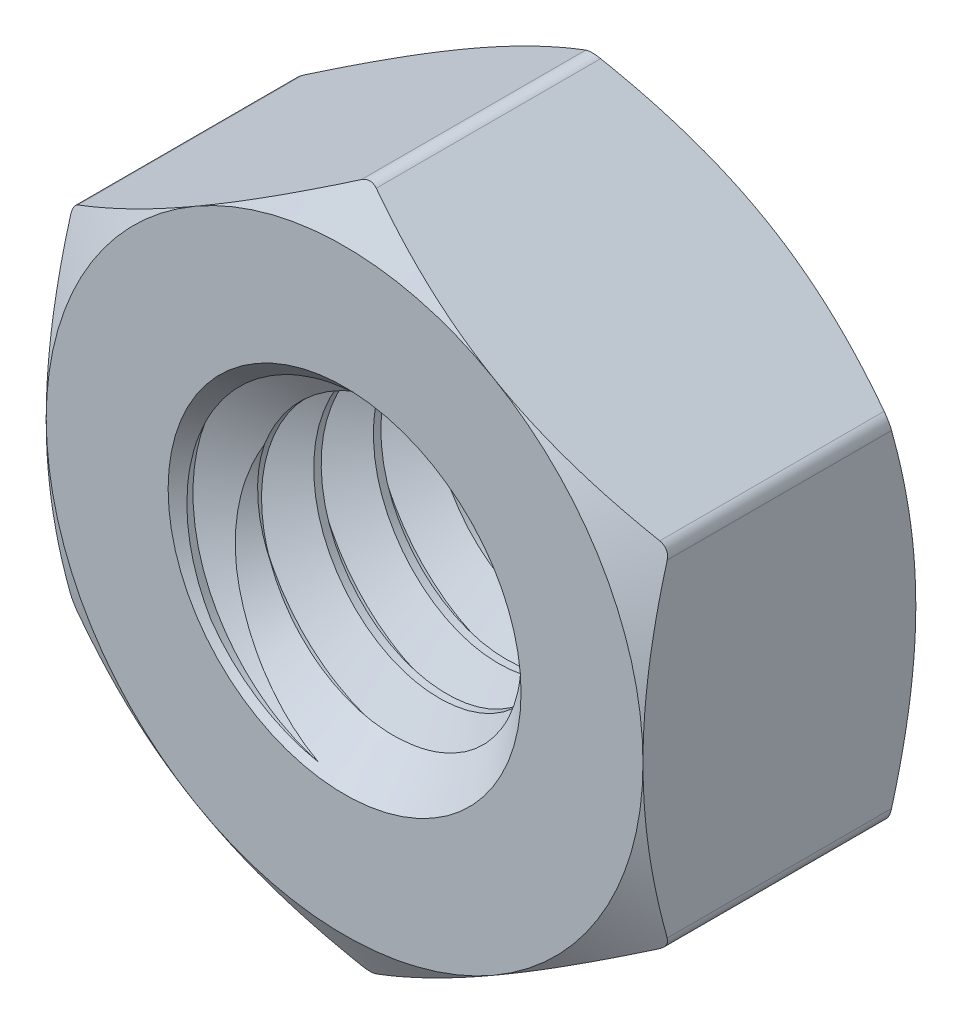
from build123d import *

# Parameters (mm, degrees)
BOSS_EXTRUDE2_DEPTH     = 1.6
CUT_EXTRUDE4_DEPTH      = 6.580621232
CUT_EXTRUDE4_DEPTH_BACK = 6.580621232
SKETCH16_R              = 2
SKETCH7_OUTSIDE_W       = 36.28
SKETCH7_OUTSIDE_H       = 37.362
SKETCH7_OUTSIDE_R       = 3.5
CUT_EXTRUDE5_DEPTH      = 7.23083729
CUT_EXTRUDE5_DRAFT      = -60
MIRROR4_COPY_1_SKETCH_W = 36.28
MIRROR4_COPY_1_SKETCH_H = 37.362
MIRROR4_COPY_1_SKETCH_R = 3.5
MIRROR4_COPY_1_DEPTH    = 7.23083729
MIRROR4_COPY_1_DRAFT    = -60
FILLET2_R               = 0.175
SKETCH13_R              = 2
BOSS_EXTRUDE1_DEPTH     = 3.2
CUT_SWEEP1_PITCH        = 0.7
SKETCH17_R              = 2
BOSS_EXTRUDE3_DEPTH     = 3.2


with BuildPart() as part:
    # Sketch15 → Boss-Extrude2 (new, symmetric)
    with BuildSketch(Plane.XY):
        Polygon((0, 4.041451884), (-3.5, 2.020725942), (-3.5, -2.020725942), (0, -4.041451884), (3.5, -2.020725942), (3.5, 2.020725942), align=None)
    extrude(amount=BOSS_EXTRUDE2_DEPTH, both=True)

    # Sketch16 → Cut-Extrude4 (cut, two sides: drawn at the far end of the back side and taken through both)
    with BuildSketch(Plane.XY.offset(-CUT_EXTRUDE4_DEPTH_BACK)):
        Circle(SKETCH16_R)
    extrude(amount=CUT_EXTRUDE4_DEPTH + CUT_EXTRUDE4_DEPTH_BACK, mode=Mode.SUBTRACT)


with BuildPart() as cut_extrude5_tool:
    # Sketch7 outside → Cut-Extrude5 (with draft: the straight prism first)
    with BuildSketch(Plane.XY.offset(1.6)):
        Rectangle(SKETCH7_OUTSIDE_W, SKETCH7_OUTSIDE_H)
        Circle(SKETCH7_OUTSIDE_R, mode=Mode.SUBTRACT)
    extrude(amount=-CUT_EXTRUDE5_DEPTH)
    # Cut-Extrude5: the draft: its side faces are tilted about the plane it starts from
    cut_extrude5_sides = [cut_extrude5_tool.faces().sort_by_distance(p)[0] for p in [
        (0, -18.681, -2.015418645),
        (18.14, 0, -2.015418645),
        (0, 18.681, -2.015418645),
        (-18.14, 0, -2.015418645),
        (-3.5, 0, -2.015418645),
    ]]
    draft(cut_extrude5_sides, Plane.XY.offset(1.6), CUT_EXTRUDE5_DRAFT)


with BuildPart() as part_1:
    add(part.part)

    # Cut-Extrude5: cut by cut_extrude5_tool
    add(cut_extrude5_tool.part, mode=Mode.SUBTRACT)


with BuildPart() as mirror4_copy_1_tool:
    # Mirror4 copy 1 sketch → Mirror4 copy 1 (with draft: the straight prism first)
    with BuildSketch(Plane(origin=(0, 0, -1.6), x_dir=(1, 0, 0), z_dir=(0, 0, -1))):
        Rectangle(MIRROR4_COPY_1_SKETCH_W, MIRROR4_COPY_1_SKETCH_H)
        Circle(MIRROR4_COPY_1_SKETCH_R, mode=Mode.SUBTRACT)
    extrude(amount=-MIRROR4_COPY_1_DEPTH)
    # Mirror4 copy 1: the draft: its side faces are tilted about the plane it starts from
    mirror4_copy_1_sides = [mirror4_copy_1_tool.faces().sort_by_distance(p)[0] for p in [
        (0, -18.681, 2.015418645),
        (18.14, 0, 2.015418645),
        (0, 18.681, 2.015418645),
        (-18.14, 0, 2.015418645),
        (-3.5, 0, 2.015418645),
    ]]
    draft(mirror4_copy_1_sides, Plane(origin=(0, 0, -1.6), x_dir=(1, 0, 0), z_dir=(0, 0, -1)), MIRROR4_COPY_1_DRAFT)


with BuildPart() as part_2:
    add(part_1.part)

    # Mirror4 copy 1: cut by mirror4_copy_1_tool
    add(mirror4_copy_1_tool.part, mode=Mode.SUBTRACT)

    # Fillet2
    fillet2_edges = [part_2.edges().sort_by_distance(p)[0] for p in [
        (-3.5, 2.020725942, 0),
        (-3.5, -2.020725942, 0),
        (0, -4.041451884, 0),
        (3.5, -2.020725942, 0),
        (3.5, 2.020725942, 0),
        (0, 4.041451884, 0),
    ]]
    fillet(fillet2_edges, radius=FILLET2_R)

    # Sketch17 → Boss-Extrude3 (add)
    with BuildSketch(Plane.XY.offset(1.6)):
        Circle(SKETCH17_R)
    extrude(amount=-BOSS_EXTRUDE3_DEPTH)


with BuildPart() as body_2:
    # Sketch13 → Boss-Extrude1 (new body)
    with BuildSketch(Plane(origin=(0, 0, -1.6), x_dir=(-1, 0, 0), z_dir=(0, 0, -1))):
        Circle(SKETCH13_R)
    extrude(amount=-BOSS_EXTRUDE1_DEPTH)

    # Cut-Sweep1: the profile of Sketch12 profile screwed along a right-hand helix of 6.571429 turns, 6 arcs to a turn; built about Z, then put on its axis
    cut_sweep1_z = Axis((0, 0, 0), (0, 0, 1))
    cut_sweep1_corners = [(2.0003, 0, -0.612673205), (2.0003, 0, 0.000173205), (1.545336663, 0, -0.2625), (1.545336663, 0, -0.35)]
    with BuildLine(mode=Mode.PRIVATE) as cut_sweep1_profile:
        Line(cut_sweep1_corners[0], cut_sweep1_corners[1])
        Line(cut_sweep1_corners[1], cut_sweep1_corners[2])
        Line(cut_sweep1_corners[2], cut_sweep1_corners[3])
        Line(cut_sweep1_corners[3], cut_sweep1_corners[0])
    cut_sweep1_cap = Face(cut_sweep1_profile.wire())
    cut_sweep1_turn_angles = [0, 30, 60, 90, 120, 150, 180, 210, 240, 270, 300, 330, 360]
    cut_sweep1_turn_weights = [1, 0.8660254037844387, 1, 0.8660254037844387, 1, 0.8660254037844387, 1, 0.8660254037844387, 1, 0.8660254037844387, 1, 0.8660254037844387, 1]
    cut_sweep1_turn_rails = [Edge.make_bspline([Vector(p[0], p[1], 0).rotate(cut_sweep1_z, cut_sweep1_turn_angles[k]) / cut_sweep1_turn_weights[k] + Vector(0, 0, p[2] + CUT_SWEEP1_PITCH * cut_sweep1_turn_angles[k] / 360) for k in range(13)], [0, 0, 0, 1, 1, 2, 2, 3, 3, 4, 4, 5, 5, 6, 6, 6], 2, cut_sweep1_turn_weights) for p in cut_sweep1_corners]
    cut_sweep1_turn_sides = [Face.make_surface_from_curves(cut_sweep1_turn_rails[p[0]], cut_sweep1_turn_rails[p[1]]) for p in [(0, 1), (1, 2), (2, 3), (3, 0)]]
    cut_sweep1_last_angles = [2160, 2190, 2220, 2250, 2280, 2310, 2340, 2352.857142857, 2365.714285714]
    cut_sweep1_last_weights = [1, 0.8660254037844387, 1, 0.8660254037844387, 1, 0.8660254037844387, 1, 0.9749279121818208, 1]
    cut_sweep1_last_rails = [Edge.make_bspline([Vector(p[0], p[1], 0).rotate(cut_sweep1_z, cut_sweep1_last_angles[k]) / cut_sweep1_last_weights[k] + Vector(0, 0, p[2] + CUT_SWEEP1_PITCH * cut_sweep1_last_angles[k] / 360) for k in range(9)], [0, 0, 0, 1, 1, 2, 2, 3, 3, 4, 4, 4], 2, cut_sweep1_last_weights) for p in cut_sweep1_corners]
    cut_sweep1_last_sides = [Face.make_surface_from_curves(cut_sweep1_last_rails[p[0]], cut_sweep1_last_rails[p[1]]) for p in [(0, 1), (1, 2), (2, 3), (3, 0)]]
    cut_sweep1 = Plane(origin=(0, 0, -1.6), x_dir=(0, 1, 0), z_dir=(0, 0, 1)) * Solid(Shell([*[p.moved(Location((0, 0, CUT_SWEEP1_PITCH * i))) for i in range(6) for p in cut_sweep1_turn_sides], *cut_sweep1_last_sides, cut_sweep1_cap, cut_sweep1_cap.rotate(cut_sweep1_z, 2365.714285714).moved(Location((0, 0, CUT_SWEEP1_PITCH * 2365.714285714 / 360)))]))
    add(cut_sweep1, mode=Mode.SUBTRACT)


with BuildPart() as part_3:
    add(part_2.part)

    # Combine1: cut body 2
    add(body_2.part, mode=Mode.SUBTRACT)

    # Cut-Extrude2 cone 1 section (through the dimple's axis) → Cut-Extrude2 (revolve, cut)
    with BuildSketch(Plane(origin=(0, 0, 1.6), x_dir=(0, -1, 0), z_dir=(1, 0, 0))):
        Polygon((0, 0), (2.07, 0), (0, 2.07), align=None)
    revolve(axis=Axis((0, 0, 1.6), (0, 0, -1)), mode=Mode.SUBTRACT)

    # Cut-Extrude3 cone 1 section (through the dimple's axis) → Cut-Extrude3 (revolve, cut)
    with BuildSketch(Plane(origin=(0, 0, -1.6), x_dir=(0, 1, 0), z_dir=(1, 0, 0))):
        Polygon((0, 0), (2.07, 0), (0, 2.07), align=None)
    revolve(axis=Axis((0, 0, -1.6), (0, 0, 1)), mode=Mode.SUBTRACT)


solid = part_3.part
